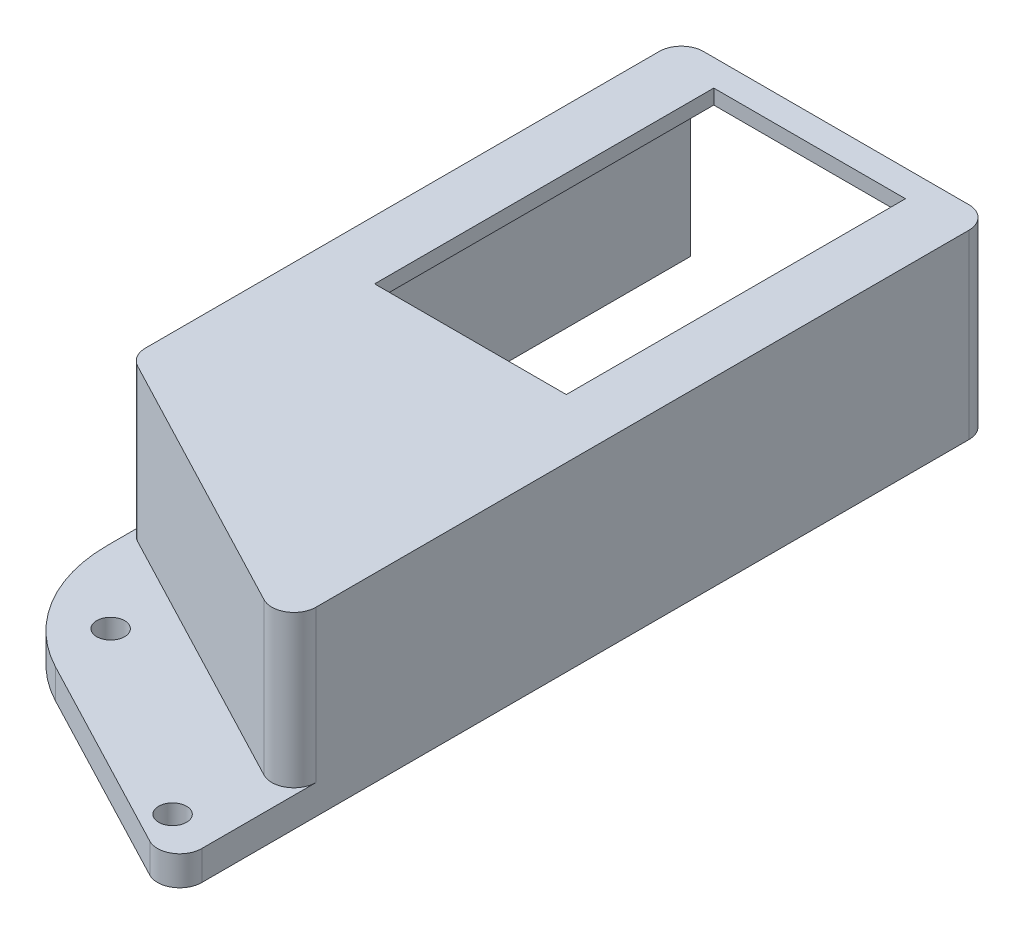
from build123d import *

# Parameters (mm, degrees)
BOSS_EXTRUDE1_DEPTH   = 12.3
BOSS_EXTRUDE1_2_DEPTH = 12.3
SKETCH1_3_W           = 13
SKETCH1_3_H           = 23
BOSS_EXTRUDE2_DEPTH   = 1
SKETCH1_4_R           = 0.946305397
BOSS_EXTRUDE3_DEPTH   = 12.3
SKETCH1_6_R           = 0.946305397
CUT_EXTRUDE2_DEPTH    = 10.3
FILLET1_R             = 10
FILLET2_R             = 1.5


with BuildPart() as part:
    # Sketch1 → Boss-Extrude1 (new body)
    with BuildSketch(Plane(origin=(0, 0, 0), x_dir=(1, 0, 0), z_dir=(0, 1, 0))):
        Polygon((-9.7, 0), (-10.5, 0), (-10.5, -35.574062231), (-9.7, -35.99310985), align=None)
    extrude(amount=-BOSS_EXTRUDE1_DEPTH)



with BuildPart() as body_2:
    # Sketch1 → Boss-Extrude1 2 (new body)
    with BuildSketch(Plane(origin=(0, 0, 0), x_dir=(1, 0, 0), z_dir=(0, 1, 0))):
        Polygon((10.5, 0), (9.7, 0), (9.7, -46.155014612), (10.5, -46.574062231), align=None)
    extrude(amount=-BOSS_EXTRUDE1_2_DEPTH)


with BuildPart() as part_1:
    add(part.part)

    add(body_2.part)  # Boss-Extrude2 merges body 2
    # Sketch1<3> → Boss-Extrude2 (add)
    with BuildSketch(Plane(origin=(0, 0, 0), x_dir=(1, 0, 0), z_dir=(0, 1, 0))):
        Polygon((9.7, 0), (-9.7, 0), (-9.7, -36.489905511), (-10.5, -36.489905511), (-10.5, -37.250622364), (10.5, -48.250622364), (10.5, -46.642015581), (9.7, -46.642015581), align=None)
        with Locations((0, -13.300665343)):
            Rectangle(SKETCH1_3_W, SKETCH1_3_H, mode=Mode.SUBTRACT)
    extrude(amount=-BOSS_EXTRUDE2_DEPTH)

    # Sketch1<4> → Boss-Extrude3 (add)
    with BuildSketch(Plane(origin=(0, 0, 0), x_dir=(1, 0, 0), z_dir=(0, 1, 0))):
        Polygon((-10.5, -35.574062231), (-10.5, -45), (10.5, -56), (10.5, -46.574062231), align=None)
        with Locations((7.5, -52.5)):
            Circle(SKETCH1_4_R, mode=Mode.SUBTRACT)
        with Locations((-5.5, -43.7)):
            Circle(SKETCH1_4_R, mode=Mode.SUBTRACT)
    extrude(amount=-BOSS_EXTRUDE3_DEPTH)

    # Sketch1<6> → Cut-Extrude2 (cut)
    with BuildSketch(Plane(origin=(0, 0, 0), x_dir=(1, 0, 0), z_dir=(0, 1, 0))):
        Polygon((10.5, -48.250622364), (-10.5, -37.250622364), (-10.5, -45), (10.5, -56), align=None)
        with Locations((-5.5, -43.7)):
            Circle(SKETCH1_6_R, mode=Mode.SUBTRACT)
        with Locations((7.5, -52.5)):
            Circle(SKETCH1_6_R, mode=Mode.SUBTRACT)
    extrude(amount=-CUT_EXTRUDE2_DEPTH, mode=Mode.SUBTRACT)

    # Fillet1
    fillet1_edges = [part_1.edges().sort_by_distance(p)[0] for p in [
        (-10.5, -11.3, 45),
    ]]
    fillet(fillet1_edges, radius=FILLET1_R)

    # Fillet2
    fillet2_edges = [part_1.edges().sort_by_distance(p)[0] for p in [
        (10.5, -6.15, 0),
        (10.5, -11.3, 56),
        (10.5, -5.15, 48.250622364),
        (-10.5, -6.15, 0),
        (-10.5, -5.15, 37.250622364),
    ]]
    fillet(fillet2_edges, radius=FILLET2_R)


solid = part_1.part
